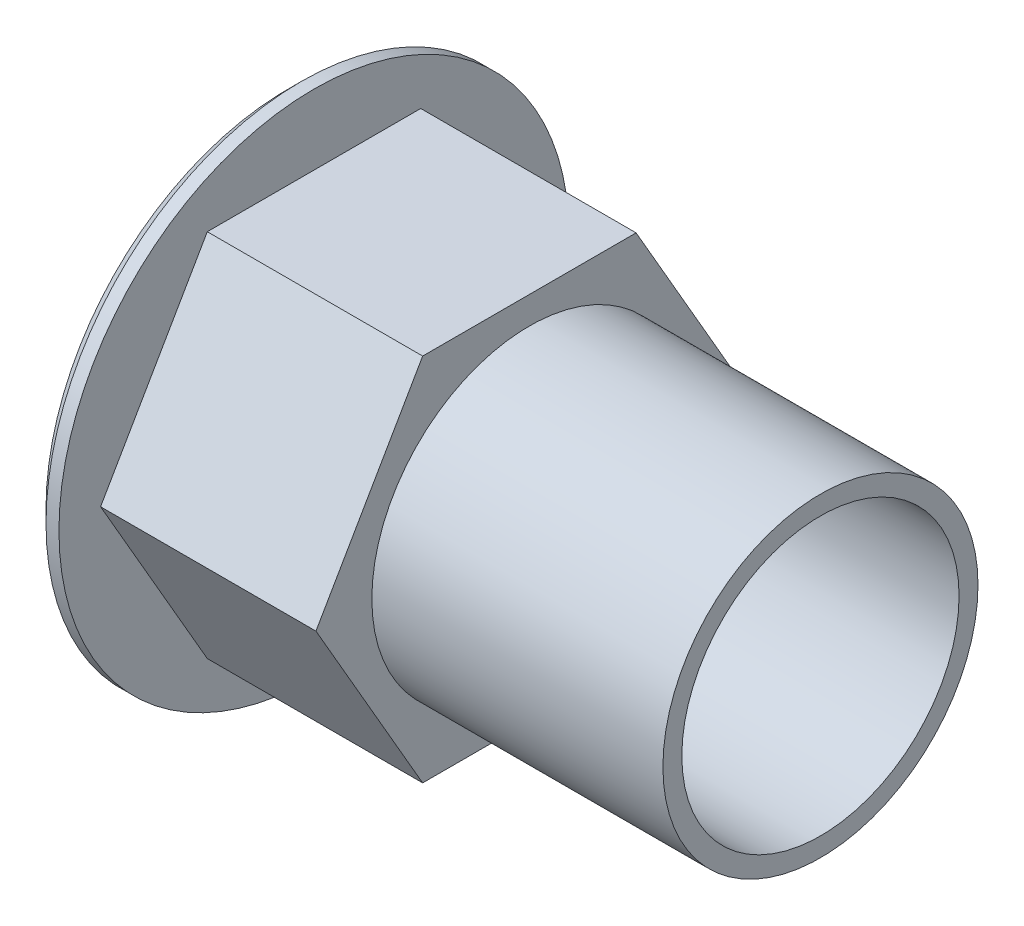
from build123d import *

# Parameters (mm, degrees)
EXTRUDE1_START = 7.399
SKETCH2_R      = 5.4125
EXTRUDE1_DEPTH = 7.399


with BuildPart() as part:
    # Sketch1 → Revolve1 (revolve)
    with BuildSketch(Plane.XY):
        Polygon((0, 4.7625), (0, 8.3185), (0.4445, 8.763), (0.889, 8.763), (0.889, 5.4125), (18.288, 5.4125), (18.288, 4.7625), align=None)
    revolve(axis=Axis((0, 0, 0), (1, 0, 0)))

    # Sketch2 → Extrude1 (add)
    with BuildSketch(Plane(origin=(0.889, 0, 0), x_dir=(0, 0, -1), z_dir=(1, 0, 0)).offset(EXTRUDE1_START)):
        Polygon((7.332348419, 0), (3.666174209, 6.35), (-3.666174209, 6.35), (-7.332348419, 0), (-3.666174209, -6.35), (3.666174209, -6.35), align=None)
        Circle(SKETCH2_R, mode=Mode.SUBTRACT)
    extrude(amount=-EXTRUDE1_DEPTH)


solid = part.part
